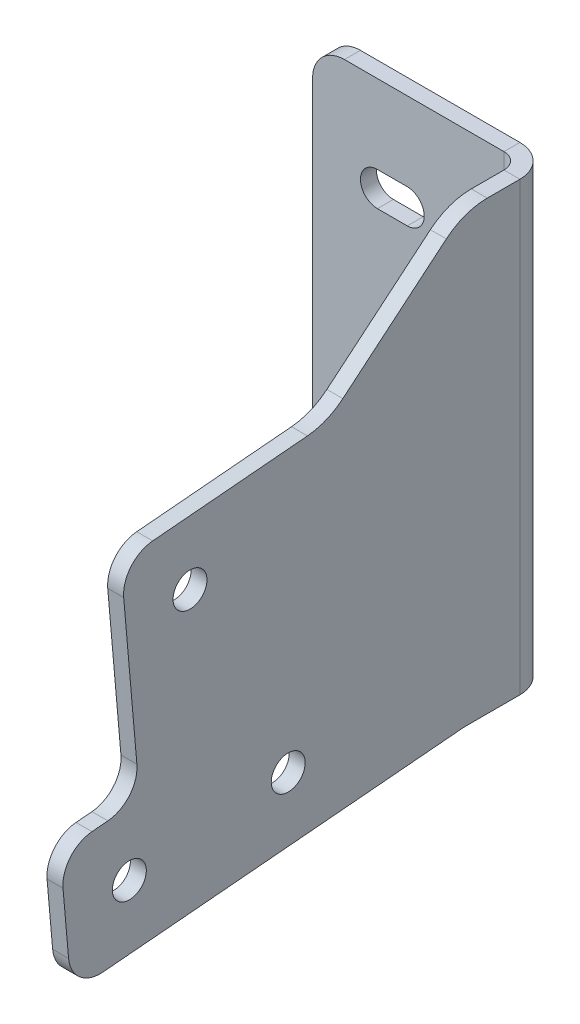
from build123d import *

# Parameters (mm, degrees)
SKETCH1_W                    = 44.45
SKETCH1_H                    = 88.9
BASE_FLANGE1_DEPTH           = 3.175
EDGE_FLANGE1_STRIP_W         = 19.05
EDGE_FLANGE1_STRIP_H         = 3.175
EDGE_FLANGE1_STRIP_CUT_DEPTH = 88.9
EDGE_FLANGE1_DEPTH           = 88.9
BOSS_EXTRUDE1_DEPTH          = 3.175
F_1_4_START                  = -3.175
F_1_4_CLEARANCE_SLOT1_DEPTH  = 3.175
F_1_4_CLEARANCE_HOLE1_D      = 6.7564
CUT_EXTRUDE1_DEPTH           = 139.903982124
FILLET1_R                    = 12.7
FILLET2_R                    = 6.35


# Read off the part's stored shape, not the designer's step: 1/4 Clearance Slot1
# Sheet-metal steps are written as plain solids
with BuildPart() as part:
    # Sketch1 → Base-Flange1 (new body)
    with BuildSketch(Plane.XY):
        with Locations((-22.225, 44.45)):
            Rectangle(SKETCH1_W, SKETCH1_H)
    extrude(amount=-BASE_FLANGE1_DEPTH)

    # Edge-Flange1 strip (across the edge) → Edge-Flange1 strip cut (cut)
    with BuildSketch(Plane(origin=(0, 0, 0), x_dir=(-1, 0, 0), z_dir=(0, 1, 0))):
        with Locations((-3.175, -1.5875)):
            Rectangle(EDGE_FLANGE1_STRIP_W, EDGE_FLANGE1_STRIP_H)
    extrude(amount=EDGE_FLANGE1_STRIP_CUT_DEPTH, mode=Mode.SUBTRACT)

    # Edge-Flange1 section (across the edge) → Edge-Flange1 (add)
    with BuildSketch(Plane(origin=(0, 0, 0), x_dir=(-1, 0, 0), z_dir=(0, 1, 0))):
        with BuildLine():
            Line((0, 3.175), (0, 14.2875))
            Line((0, 14.2875), (3.175, 14.2875))
            Line((3.175, 14.2875), (3.175, 3.175))
            ThreePointArc((3.175, 3.175), (4.10493597, 0.92993597), (6.35, 0))
            Line((6.35, 0), (6.35, -3.175))
            ThreePointArc((6.35, -3.175), (1.859871939, -1.315128061), (0, 3.175))
        make_face()
    extrude(amount=EDGE_FLANGE1_DEPTH)

    # Sketch9 → Boss-Extrude1 (add)
    with BuildSketch(Plane.ZY.offset(3.175)):
        Polygon((35.543004115, -1.859615648), (92.475531111, -6.840566346), (98.425, 61.162174233), (41.492473004, 66.143124931), (14.2875, 88.9), (14.2875, 0), align=None)
    extrude(amount=-BOSS_EXTRUDE1_DEPTH)

    # 1/4 Clearance Slot1 outline → 1/4 Clearance Slot1 (cut)
    with BuildSketch(Plane.XY.offset(F_1_4_START)):
        with BuildLine():
            Line((-31.5468, 12.4968), (-25.6032, 12.4968))
            ThreePointArc((-25.6032, 12.4968), (-22.225, 15.875), (-25.6032, 19.2532))
            Line((-25.6032, 19.2532), (-31.5468, 19.2532))
            ThreePointArc((-31.5468, 19.2532), (-34.925, 15.875), (-31.5468, 12.4968))
        make_face()
        with BuildLine():
            Line((-31.5468, 66.4718), (-25.6032, 66.4718))
            ThreePointArc((-25.6032, 66.4718), (-22.225, 69.85), (-25.6032, 73.2282))
            Line((-25.6032, 73.2282), (-31.5468, 73.2282))
            ThreePointArc((-31.5468, 73.2282), (-34.925, 69.85), (-31.5468, 66.4718))
        make_face()
    extrude(amount=F_1_4_CLEARANCE_SLOT1_DEPTH, mode=Mode.SUBTRACT)

    # 1/4 Clearance Hole1 (through all)
    with Locations(Plane.ZY.offset(3.175)):
        with Locations((68.851858569, 51.000976916), (49.301554713, 9.685179085), (80.930736378, 6.917984253)):
            Hole(F_1_4_CLEARANCE_HOLE1_D / 2)

    # Sketch16 → Cut-Extrude1 (cut, through all)
    with BuildSketch(Plane.ZY.offset(3.175)):
        Polygon((82.610409168, 62.545771649), (78.874696144, 19.846376402), (94.689286976, 18.462778986), (98.425, 61.162174233), align=None)
    extrude(amount=-CUT_EXTRUDE1_DEPTH, mode=Mode.SUBTRACT)

    # Fillet1
    # the kernel refuses this fillet: 12.7 mm, written as the material it adds along each edge
    with BuildSketch(Plane(origin=(0, 0, 14.2875), x_dir=(0, 0, -1), z_dir=(-1, 0, 0))) as fillet1_piece_1:
        with BuildLine():
            CenterArc((FILLET1_R * 0.0436609429085, FILLET1_R), FILLET1_R, 265, 5)
            Line((-FILLET1_R * 0.0434947998391, FILLET1_R * 0.00380530190825), (0, 0))
            Line((0, 0), (FILLET1_R * 0.0436609429085, 0))
        make_face()
    extrude(amount=3.175)
    with BuildSketch(Plane(origin=(-3.175, 66.143124931, 41.492473004), x_dir=(-2.6754118461414173e-15, 0.6416153350460713, -0.7670265717911718), z_dir=(1, 0, 0))) as fillet1_piece_2:
        with BuildLine():
            CenterArc((FILLET1_R * 0.314458316587, FILLET1_R), FILLET1_R, 235.087623307, 34.912376693)
            Line((-FILLET1_R * 0.257864707828, FILLET1_R * 0.179971734802), (0, 0))
            Line((0, 0), (FILLET1_R * 0.314458316587, 0))
        make_face()
    extrude(amount=3.175)
    # the kernel refuses this fillet: 12.7 mm, written as the material it takes off along each edge
    with BuildSketch(Plane(origin=(11.528568508, 88.9, 14.2875), x_dir=(0, 0, -1), z_dir=(-1, 0, 0))) as fillet1_2_piece_1:
        with BuildLine():
            CenterArc((FILLET1_R * 0.363104519926, FILLET1_R), FILLET1_R, 230.087623307, 39.912376693)
            Line((-FILLET1_R * 0.27851081512, FILLET1_R * 0.232973428209), (0, 0))
            Line((0, 0), (FILLET1_R * 0.363104519926, 0))
        make_face()
    extrude(amount=26.232137015, mode=Mode.SUBTRACT)

    # Fillet2
    fillet2_edges = [part.edges().sort_by_distance(p)[0] for p in [
        (-1.5875, 18.462778986, 94.689286976),
        (-1.5875, 62.545771649, 82.610409168),
        (-1.5875, 19.846376402, 78.874696144),
        (-1.5875, -6.840566346, 92.475531111),
        (-44.45, 88.9, -1.5875),
        (-44.45, 0, -1.5875),
    ]]
    fillet(fillet2_edges, radius=FILLET2_R)


solid = part.part
